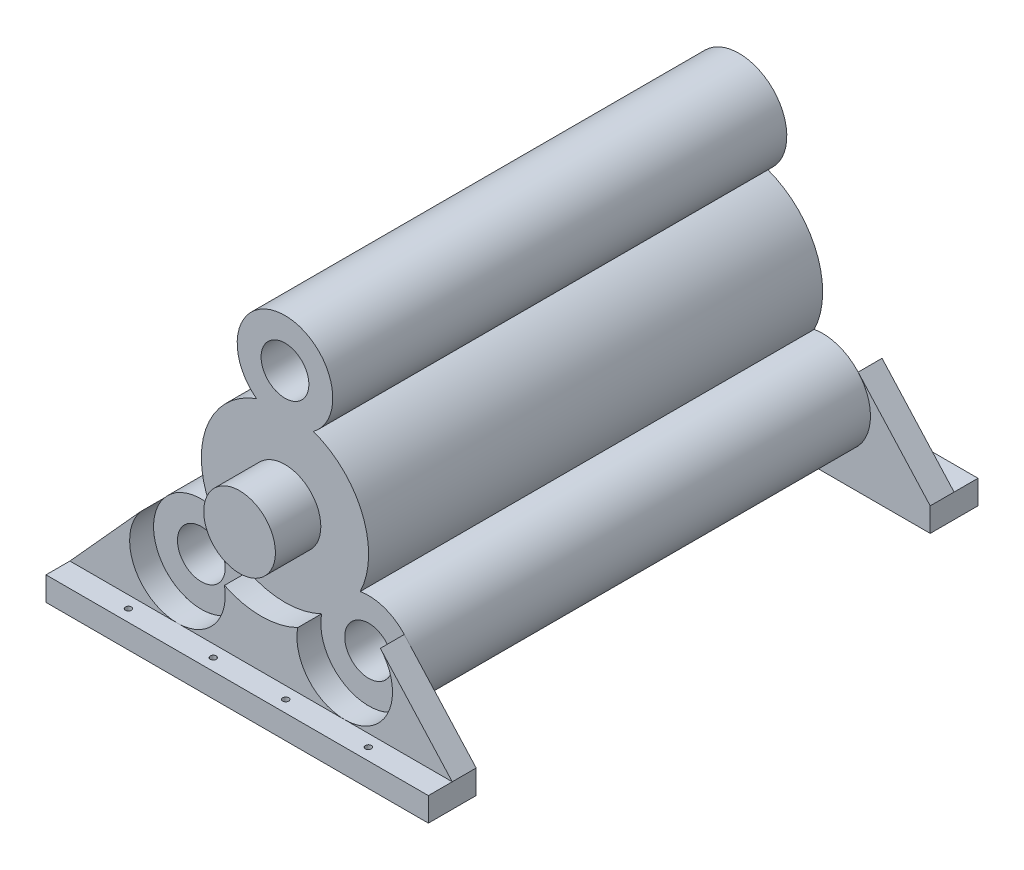
from build123d import *

# Parameters (mm, degrees)
BOSS_EXTRUDE1_DEPTH   = 48.26
SKETCH2_R             = 2.54
CUT_EXTRUDE1_DEPTH    = 52.07
BOSS_EXTRUDE2_DEPTH   = 2.54
BOSS_EXTRUDE5_DEPTH   = 2.54
BOSS_EXTRUDE5_2_DEPTH = 2.54
BOSS_EXTRUDE5_3_DEPTH = 2.54
SKETCH6_W             = 40.64
SKETCH6_H             = 2.54
BOSS_EXTRUDE6_DEPTH   = 2.54
SKETCH7_W             = 40.64
SKETCH7_H             = 2.54
BOSS_EXTRUDE7_DEPTH   = 2.54
SKETCH8_W             = 40.64
SKETCH8_H             = 2.54
BOSS_EXTRUDE8_DEPTH   = 2.54
SKETCH9_W             = 40.64
SKETCH9_H             = 2.54
BOSS_EXTRUDE9_DEPTH   = 2.54
SKETCH10_R            = 0.3175
CUT_EXTRUDE2_DEPTH    = 7.366
SKETCH11_R            = 0.3175
CUT_EXTRUDE3_DEPTH    = 7.366
SKETCH12_R            = 3.81
BOSS_EXTRUDE10_DEPTH  = 4.826


# Read off the part's stored shape, not the designer's step: Boss-Extrude2
with BuildPart() as part:
    # Sketch1 → Boss-Extrude1 (new body)
    with BuildSketch(Plane.XY):
        with BuildLine():
            ThreePointArc((-3.020156036, 8.361265306), (-8.237032921, 3.344157391), (-7.993914493, -3.889656935))
            ThreePointArc((-7.993914493, -3.889656935), (-12.482102448, -12.482102448), (-3.889656935, -7.993914493))
            ThreePointArc((-3.889656935, -7.993914493), (0, -8.89), (3.889656935, -7.993914493))
            ThreePointArc((3.889656935, -7.993914493), (12.482102448, -12.482102448), (7.993914493, -3.889656935))
            ThreePointArc((7.993914493, -3.889656935), (8.237032921, 3.344157391), (3.020156036, 8.361265306))
            ThreePointArc((3.020156036, 8.361265306), (0, 17.526), (-3.020156036, 8.361265306))
        make_face()
    extrude(amount=BOSS_EXTRUDE1_DEPTH)

    # Sketch2 → Cut-Extrude1 (cut)
    with BuildSketch(Plane.XY.offset(48.26)):
        with Locations((0, 12.446)):
            Circle(SKETCH2_R)
        with Locations((-8.89, -8.89)):
            Circle(SKETCH2_R)
        with Locations((8.89, -8.89)):
            Circle(SKETCH2_R)
    extrude(amount=-CUT_EXTRUDE1_DEPTH, mode=Mode.SUBTRACT)



with BuildPart() as body_2:
    # Boss-Extrude2 outline → Boss-Extrude2 (new body)
    with BuildSketch(Plane.XY.offset(48.26)):
        with BuildLine():
            ThreePointArc((-8.89, -13.97), (-13.479227022, -11.068392835), (-12.825881599, -5.678265883))
            Line((-12.825881599, -5.678265883), (-20.32, -13.97))
            Line((-20.32, -13.97), (-8.89, -13.97))
        make_face()
        with BuildLine():
            ThreePointArc((12.676802642, -5.503774115), (13.527263606, -10.964171221), (8.89, -13.97))
            Line((8.89, -13.97), (20.32, -13.97))
            Line((20.32, -13.97), (12.676802642, -5.503774115))
        make_face()
        with BuildLine():
            ThreePointArc((-3.889656935, -7.993914493), (-4.99394338, -12.149929879), (-8.89, -13.97))
            Line((-8.89, -13.97), (8.89, -13.97))
            ThreePointArc((8.89, -13.97), (4.99394338, -12.149929879), (3.889656935, -7.993914493))
            ThreePointArc((3.889656935, -7.993914493), (0, -8.89), (-3.889656935, -7.993914493))
        make_face()
    extrude(amount=BOSS_EXTRUDE2_DEPTH)


with BuildPart() as body_3:
    # Sketch5 → Boss-Extrude5 (new body)
    with BuildSketch(Plane(origin=(0, 0, 0), x_dir=(-1, 0, 0), z_dir=(0, 0, -1))):
        with BuildLine():
            Line((-12.660721649, -5.485876288), (-20.32, -13.97))
            Line((-20.32, -13.97), (-8.89, -13.97))
            ThreePointArc((-8.89, -13.97), (-13.532162667, -10.953183407), (-12.660721649, -5.485876288))
        make_face()
    extrude(amount=BOSS_EXTRUDE5_DEPTH)



with BuildPart() as body_4:
    # Sketch5 → Boss-Extrude5 2 (new body)
    with BuildSketch(Plane(origin=(0, 0, 0), x_dir=(-1, 0, 0), z_dir=(0, 0, -1))):
        with BuildLine():
            ThreePointArc((-3.889656935, -7.993914493), (-4.99394338, -12.149929879), (-8.89, -13.97))
            Line((-8.89, -13.97), (8.89, -13.97))
            ThreePointArc((8.89, -13.97), (4.99394338, -12.149929879), (3.889656935, -7.993914493))
            ThreePointArc((3.889656935, -7.993914493), (0, -8.89), (-3.889656935, -7.993914493))
        make_face()
    extrude(amount=BOSS_EXTRUDE5_2_DEPTH)


with BuildPart() as body_5:
    # Sketch5 → Boss-Extrude5 3 (new body)
    with BuildSketch(Plane(origin=(0, 0, 0), x_dir=(-1, 0, 0), z_dir=(0, 0, -1))):
        with BuildLine():
            ThreePointArc((12.660721649, -5.485876288), (13.532162667, -10.953183407), (8.89, -13.97))
            Line((8.89, -13.97), (20.32, -13.97))
            Line((20.32, -13.97), (12.660721649, -5.485876288))
        make_face()
    extrude(amount=BOSS_EXTRUDE5_3_DEPTH)


with BuildPart() as part_1:
    add(part.part)

    add(body_2.part)  # Boss-Extrude6 merges body 2
    # Sketch6 → Boss-Extrude6 (add)
    with BuildSketch(Plane.XY.offset(50.8)):
        with Locations((0, -15.24)):
            Rectangle(SKETCH6_W, SKETCH6_H)
    extrude(amount=-BOSS_EXTRUDE6_DEPTH)

    # Sketch7 → Boss-Extrude7 (add)
    with BuildSketch(Plane.XY.offset(50.8)):
        with Locations((0, -15.24)):
            Rectangle(SKETCH7_W, SKETCH7_H)
    extrude(amount=BOSS_EXTRUDE7_DEPTH)

    # Sketch11 → Cut-Extrude3 (cut)
    with BuildSketch(Plane(origin=(0, -13.97, 0), x_dir=(1, 0, 0), z_dir=(0, 1, 0))):
        with Locations(Location((-12.825881599, -52.07, 0), (0, 0, 270))):
            Circle(SKETCH11_R)
        with Locations(Location((-3.81, -52.07, 0), (0, 0, 270))):
            Circle(SKETCH11_R)
        with Locations(Location((3.889656935, -52.07, 0), (0, 0, 270))):
            Circle(SKETCH11_R)
        with Locations(Location((12.676802642, -52.07, 0), (0, 0, 270))):
            Circle(SKETCH11_R)
    extrude(amount=-CUT_EXTRUDE3_DEPTH, mode=Mode.SUBTRACT)

    # Sketch12 → Boss-Extrude10 (add)
    with BuildSketch(Plane.XY.offset(48.26)):
        Circle(SKETCH12_R)
    extrude(amount=BOSS_EXTRUDE10_DEPTH)


with BuildPart() as body_3_1:
    add(body_3.part)

    add(body_4.part)  # Boss-Extrude8 merges body 4

    add(body_5.part)  # Boss-Extrude8 merges body 5
    # Sketch8 → Boss-Extrude8 (add)
    with BuildSketch(Plane(origin=(0, 0, -2.54), x_dir=(-1, 0, 0), z_dir=(0, 0, -1))):
        with Locations((0, -15.24)):
            Rectangle(SKETCH8_W, SKETCH8_H)
    extrude(amount=-BOSS_EXTRUDE8_DEPTH)

    # Sketch9 → Boss-Extrude9 (add)
    with BuildSketch(Plane(origin=(0, 0, -2.54), x_dir=(-1, 0, 0), z_dir=(0, 0, -1))):
        with Locations((0, -15.24)):
            Rectangle(SKETCH9_W, SKETCH9_H)
    extrude(amount=BOSS_EXTRUDE9_DEPTH)

    # Sketch10 → Cut-Extrude2 (cut)
    with BuildSketch(Plane(origin=(0, -13.97, 0), x_dir=(1, 0, 0), z_dir=(0, 1, 0))):
        with Locations(Location((-12.660721649, 3.81, 0), (0, 0, 270))):
            Circle(SKETCH10_R)
        with Locations(Location((-3.889656935, 3.81, 0), (0, 0, 270))):
            Circle(SKETCH10_R)
        with Locations(Location((3.889656935, 3.81, 0), (0, 0, 270))):
            Circle(SKETCH10_R)
        with Locations(Location((12.660721649, 3.81, 0), (0, 0, 270))):
            Circle(SKETCH10_R)
    extrude(amount=-CUT_EXTRUDE2_DEPTH, mode=Mode.SUBTRACT)


solid = Compound([part_1.part, body_3_1.part])
